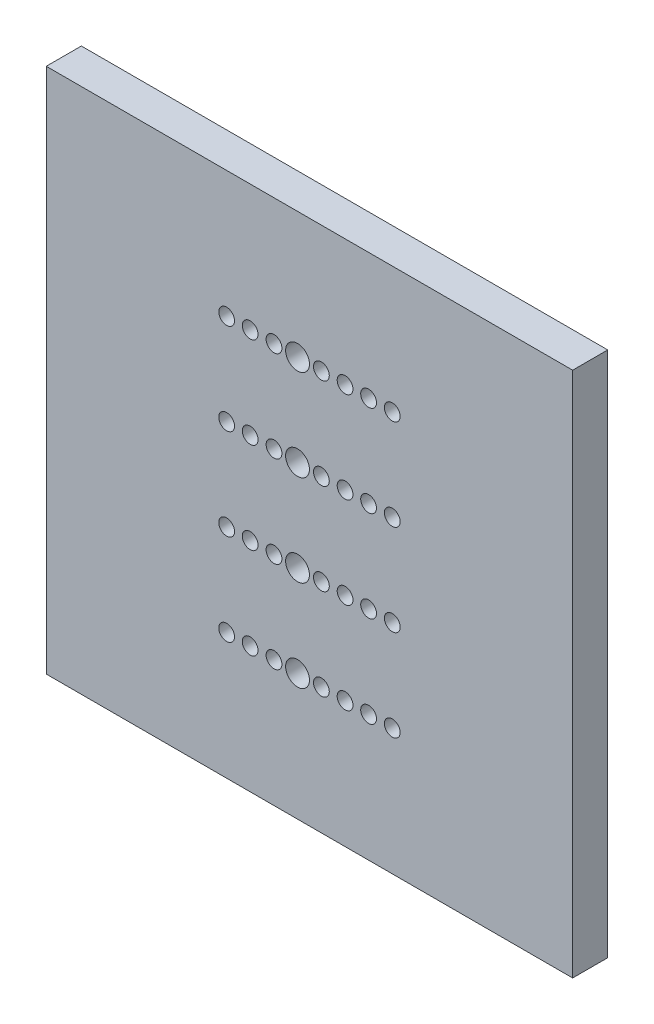
from build123d import *

# Parameters (mm, degrees)
ESQUISSE2_W             = 30
ESQUISSE2_H             = 30
BOSS_EXTRU_1_DEPTH      = 2
ESQUISSE3_R             = 0.45
ESQUISSE3_R_2           = 0.68
ENL_V_MAT_EXTRU_1_DEPTH = 10


with BuildPart() as part:
    # Esquisse2 → Boss.-Extru.1 (new body)
    with BuildSketch(Plane.XY):
        Rectangle(ESQUISSE2_W, ESQUISSE2_H)
    extrude(amount=BOSS_EXTRU_1_DEPTH)

    # Esquisse3 → Enlèv. mat.-Extru.1 (cut)
    with BuildSketch(Plane.XY.offset(2)):
        with Locations((-4.72, -7.8)):
            Circle(ESQUISSE3_R)
        with Locations((-4.72, -2.6)):
            Circle(ESQUISSE3_R)
        with Locations((-4.72, 2.6)):
            Circle(ESQUISSE3_R)
        with Locations((-4.72, 7.8)):
            Circle(ESQUISSE3_R)
        with Locations((-3.38, -7.8)):
            Circle(ESQUISSE3_R)
        with Locations((-3.38, -2.6)):
            Circle(ESQUISSE3_R)
        with Locations((-3.38, 2.6)):
            Circle(ESQUISSE3_R)
        with Locations((-3.38, 7.8)):
            Circle(ESQUISSE3_R)
        with Locations((-2.02, -7.8)):
            Circle(ESQUISSE3_R)
        with Locations((-2.02, -2.6)):
            Circle(ESQUISSE3_R)
        with Locations((-2.02, 2.6)):
            Circle(ESQUISSE3_R)
        with Locations((-2.02, 7.8)):
            Circle(ESQUISSE3_R)
        with Locations((-0.68, -7.8)):
            Circle(ESQUISSE3_R_2)
        with Locations((-0.68, -2.6)):
            Circle(ESQUISSE3_R_2)
        with Locations((-0.68, 2.6)):
            Circle(ESQUISSE3_R_2)
        with Locations((-0.68, 7.8)):
            Circle(ESQUISSE3_R_2)
        with Locations((0.68, -7.8)):
            Circle(ESQUISSE3_R)
        with Locations((0.68, -2.6)):
            Circle(ESQUISSE3_R)
        with Locations((0.68, 2.6)):
            Circle(ESQUISSE3_R)
        with Locations((0.68, 7.8)):
            Circle(ESQUISSE3_R)
        with Locations((2.03, -7.8)):
            Circle(ESQUISSE3_R)
        with Locations((2.03, -2.6)):
            Circle(ESQUISSE3_R)
        with Locations((2.03, 2.6)):
            Circle(ESQUISSE3_R)
        with Locations((2.03, 7.8)):
            Circle(ESQUISSE3_R)
        with Locations((3.37, -7.8)):
            Circle(ESQUISSE3_R)
        with Locations((3.37, -2.6)):
            Circle(ESQUISSE3_R)
        with Locations((3.37, 2.6)):
            Circle(ESQUISSE3_R)
        with Locations((3.37, 7.8)):
            Circle(ESQUISSE3_R)
        with Locations((4.72, -7.8)):
            Circle(ESQUISSE3_R)
        with Locations((4.72, -2.6)):
            Circle(ESQUISSE3_R)
        with Locations((4.72, 2.6)):
            Circle(ESQUISSE3_R)
        with Locations((4.72, 7.8)):
            Circle(ESQUISSE3_R)
    extrude(amount=-ENL_V_MAT_EXTRU_1_DEPTH, mode=Mode.SUBTRACT)


solid = part.part
